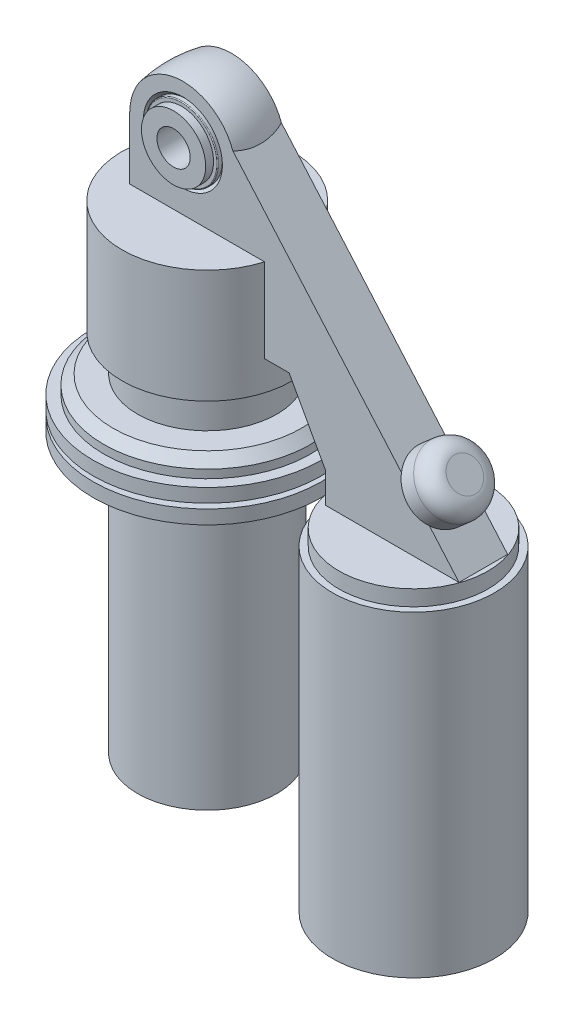
from build123d import *

# Parameters (mm, degrees)
EXTRUDE1_REACH             = 27.561
EXTRUDE1_DIRECTION_2_REACH = 27.561
SKETCH9_R                  = 9.730034016
EXTRUDE2_DEPTH             = 10
FILLET1_R                  = 5


with BuildPart() as part:
    # Sketch1 → Revolve1 (revolve)
    with BuildSketch(Plane(origin=(0, 0, 0), x_dir=(1, 0, 0), z_dir=(0, 1, 0))):
        with BuildLine():
            Line((5, 10.08849824), (5, -10.11150176))
            Line((5, -10.11150176), (9.65, -10.11150176))
            Line((9.65, -10.11150176), (9.65, -7.743710837))
            Line((9.65, -7.743710837), (10.623477626, -7.743710837))
            ThreePointArc((10.623477626, -7.743710837), (10.800254321, -7.670487532), (10.873477626, -7.493710837))
            Line((10.873477626, -7.493710837), (10.873477626, -6.327536233))
            Line((10.873477626, -6.327536233), (11.865828341, -7.31150176))
            Line((11.865828341, -7.31150176), (15.928234133, -7.31150176))
            ThreePointArc((15.928234133, -7.31150176), (16.6, -0.01150176), (15.928234133, 7.28849824))
            Line((15.928234133, 7.28849824), (11.865828341, 7.28849824))
            Line((11.865828341, 7.28849824), (10.873477626, 6.304532714))
            Line((10.873477626, 6.304532714), (10.873477626, 7.470707318))
            ThreePointArc((10.873477626, 7.470707318), (10.800254321, 7.647484013), (10.623477626, 7.720707318))
            Line((10.623477626, 7.720707318), (9.65, 7.720707318))
            Line((9.65, 7.720707318), (9.65, 10.08849824))
            Line((9.65, 10.08849824), (5, 10.08849824))
        make_face()
    revolve(axis=Axis((0, 0, -9.265426498), (0, 0, 1)))

    # Extrude1: up to this face of the body (flat: up to its plane)
    extrude1_end = Plane(part.part.faces().sort_by_distance((-12.316346835, 0, 7.31150176))[0])
    # Sketch2 → Extrude1 (add, up to the picked face)
    with BuildSketch(Plane.XY, mode=Mode.PRIVATE) as extrude1_sk1:
        with BuildLine():
            Line((-15, 0), (-16, 0))
            Line((-16, 0), (-16, -44))
            Line((-16, -44), (-0.071765867, -44))
            Line((-0.071765867, -44), (31.928234133, -44))
            Line((31.928234133, -44), (42.928234133, -64))
            Line((42.928234133, -64), (42.928234133, -73))
            Line((42.928234133, -73), (83, -73))
            Line((83, -73), (12.68857754, 8))
            ThreePointArc((12.68857754, 8), (4.163612428, -14.410563193), (-15, 0))
        make_face()
    extrude1_tool1 = split(extrude(extrude1_sk1.sketch, amount=EXTRUDE1_REACH, mode=Mode.PRIVATE), bisect_by=extrude1_end, keep=Keep.BOTH, mode=Mode.PRIVATE)
    add(extrude1_tool1.solids().sort_by(Axis((27.055284, -37.225562, 0), (0, 0, 1)))[0])

    # Extrude1 direction 2: up to this face of the body (flat: up to its plane)
    extrude1_direction_2_end = Plane(part.part.faces().sort_by_distance((-15.477715638, 0, -7.28849824))[0])
    # Sketch2 → Extrude1 direction 2 (add, up to the picked face)
    with BuildSketch(Plane.XY, mode=Mode.PRIVATE) as extrude1_direction_2_sk1:
        with BuildLine():
            Line((-15, 0), (-16, 0))
            Line((-16, 0), (-16, -44))
            Line((-16, -44), (-0.071765867, -44))
            Line((-0.071765867, -44), (31.928234133, -44))
            Line((31.928234133, -44), (42.928234133, -64))
            Line((42.928234133, -64), (42.928234133, -73))
            Line((42.928234133, -73), (83, -73))
            Line((83, -73), (12.68857754, 8))
            ThreePointArc((12.68857754, 8), (4.163612428, -14.410563193), (-15, 0))
        make_face()
    extrude1_direction_2_tool1 = split(extrude(extrude1_direction_2_sk1.sketch, amount=-EXTRUDE1_DIRECTION_2_REACH, mode=Mode.PRIVATE), bisect_by=extrude1_direction_2_end, keep=Keep.BOTH, mode=Mode.PRIVATE)
    add(extrude1_direction_2_tool1.solids().sort_by(Axis((27.055284, -37.225562, 0), (0, 0, -1)))[0])

    # Sketch5 → Revolve2 (revolve)
    with BuildSketch(Plane.XY):
        Polygon((-25.6, -18.8), (-25.6, -52.9), (-20.95, -52.9), (-20.95, -63.9), (-28.3, -63.9), (-31.1, -66.7), (-31.1, -69.2), (-34.3, -69.2), (-34.3, -73.3), (-30.4, -73.3), (-30.4, -74.8), (-34.3, -74.8), (-34.3, -78.95), (-20.95, -78.95), (-20.95, -162.65), (0, -162.65), (0, -18.8), align=None)
    revolve(axis=Axis((0, 0, 0), (0, -1, 0)))

    # Sketch9 → Extrude2 (add)
    with BuildSketch(Plane(origin=(33.351841584, -15.804444982, 0), x_dir=(0, 0, -1), z_dir=(0.7551747192232434, 0.655523564371332, 0))):
        with Locations((0, -55.738174971)):
            Circle(SKETCH9_R)
    extrude(amount=EXTRUDE2_DEPTH)

    # Fillet1
    fillet1_edges = [part.edges().sort_by_distance(p)[0] for p in [
        (77.441275905, -51.341269972, 9.730034016),
    ]]
    fillet(fillet1_edges, radius=FILLET1_R)


with BuildPart() as body_2:
    # Sketch6 → Revolve3 (revolve)
    with BuildSketch(Plane.XY):
        Polygon((86.35, -172.9), (86.35, -77.7), (84.390298743, -77.7), (84.390298743, -73), (62, -73), (62, -178.224085177), (67.443541944, -178.224085177), (68.744234949, -176.549280333), (70.341835043, -176.549280333), (70.341835043, -173.101581518), (71.778065717, -173.101581518), (73.148819822, -169.398204306), (79.985017978, -169.398204306), (81.135152976, -172.309427526), (83.011694311, -172.309427526), (84.365727387, -171.37684084), (84.365727387, -172.9), align=None)
    revolve(axis=Axis((62, -208.539898489, 0), (0, 1, 0)))


solid = Compound([part.part, body_2.part])
